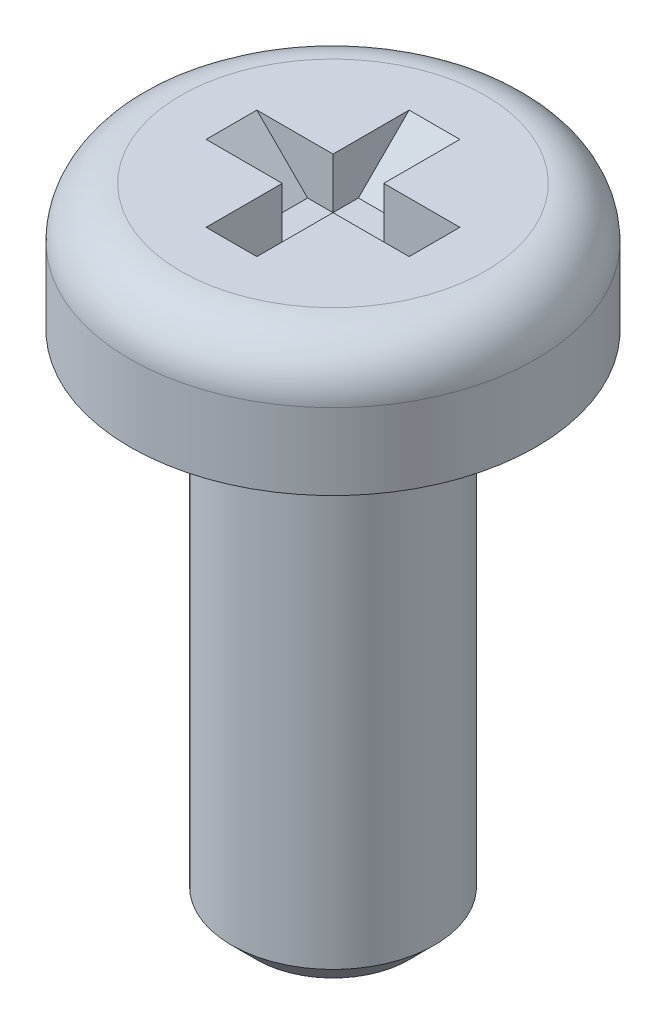
from build123d import *

# Parameters (mm, degrees)
SKETCH_1_R          = 2
EXTRUDE_1_DEPTH     = 10
SKETCH_2_R          = 4
EXTRUDE_2_DEPTH     = 2.5
FILLET_1_R          = 1
CHAMFER_1_SIZE      = 0.5
SKETCH_3_W          = 4
SKETCH_3_H          = 1
SKETCH_3_W_2        = 1
SKETCH_3_H_2        = 4
CUT_EXTRUDE_1_DEPTH = 1
CHAMFER_2_SIZE      = 1


with BuildPart() as part:
    # 草图1 → 凸台-拉伸1 (new body)
    with BuildSketch(Plane(origin=(0, 0, 0), x_dir=(1, 0, 0), z_dir=(0, 1, 0))):
        with Locations(Location((0, 0, 0), (0, 0, 270))):
            Circle(SKETCH_1_R)
    extrude(amount=EXTRUDE_1_DEPTH)

    # 草图2 → 凸台-拉伸2 (add)
    with BuildSketch(Plane(origin=(0, 10, 0), x_dir=(1, 0, 0), z_dir=(0, 1, 0))):
        with Locations(Location((0, 0, 0), (0, 0, 270))):
            Circle(SKETCH_2_R)
    extrude(amount=EXTRUDE_2_DEPTH)

    # 圆角1
    fillet_1_edges = [part.edges().sort_by_distance(p)[0] for p in [
        (0, 12.5, -4),
    ]]
    fillet(fillet_1_edges, radius=FILLET_1_R)

    # 倒角1
    chamfer_1_edges = [part.edges().sort_by_distance(p)[0] for p in [
        (0, 0, -2),
    ]]
    chamfer(chamfer_1_edges, length=CHAMFER_1_SIZE)

    # 草图3 → 切除-拉伸-薄壁1 (cut)
    with BuildSketch(Plane(origin=(0, 12.5, 0), x_dir=(1, 0, 0), z_dir=(0, 1, 0))):
        Rectangle(SKETCH_3_W, SKETCH_3_H)
        Rectangle(SKETCH_3_W_2, SKETCH_3_H_2)
    extrude(amount=-CUT_EXTRUDE_1_DEPTH, mode=Mode.SUBTRACT)

    # 倒角2
    chamfer_2_edges = [part.edges().sort_by_distance(p)[0] for p in [
        (0, 11.5, 2),
        (2, 11.5, 0),
        (0, 11.5, -2),
        (-2, 11.5, 0),
    ]]
    chamfer(chamfer_2_edges, length=CHAMFER_2_SIZE - 0.0001)  # a hair under: the kernel refuses the full size


solid = part.part
